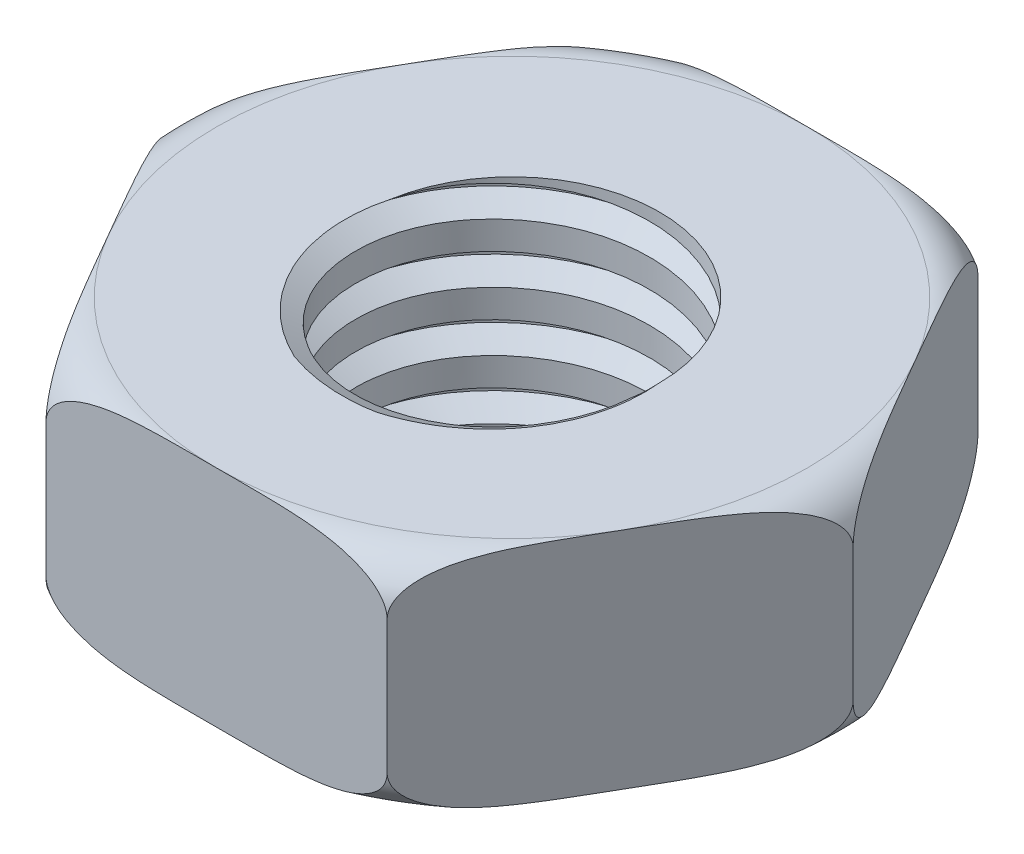
from build123d import *

# Parameters (mm, degrees)
SKETCH1_R           = 1.25
BOSS_EXTRUDE1_DEPTH = 0.95
THREAD1_PITCH       = 0.5


with BuildPart() as part:
    # Sketch1 → Boss-Extrude1 (new, symmetric)
    with BuildSketch(Plane(origin=(0, 0, 0), x_dir=(1, 0, 0), z_dir=(0, 1, 0))):
        Polygon((2.886751346, 0), (1.443375673, 2.5), (-1.443375673, 2.5), (-2.886751346, 0), (-1.443375673, -2.5), (1.443375673, -2.5), align=None)
        with Locations(Location((0, 0, 0), (0, 0, 90))):
            Circle(SKETCH1_R, mode=Mode.SUBTRACT)
    extrude(amount=BOSS_EXTRUDE1_DEPTH, both=True)

    # Cut-Revolve1: read off the stored shape, not the designer's step
    # Cut-Revolve1 outline → Cut-Revolve1 (revolve, cut)
    with BuildSketch(Plane.XY):
        with BuildLine():
            ThreePointArc((2.886751346, -0.563248654), (2.773474497, -0.836723155), (2.499999995, -0.95))
            Line((2.499999995, -0.95), (2.886751346, -0.95))
            Line((2.886751346, -0.95), (2.886751346, -0.563248654))
        make_face()
        with BuildLine():
            ThreePointArc((2.499999995, 0.95), (2.773474497, 0.836723155), (2.886751346, 0.563248654))
            Line((2.886751346, 0.563248654), (2.886751346, 0.95))
            Line((2.886751346, 0.95), (2.499999995, 0.95))
        make_face()
    revolve(axis=Axis((0, 0, 0), (0, 1, 0)), mode=Mode.SUBTRACT)

    # Thread1: arcs per turn and ends read off the stored shape
    # Thread1: the profile of Thread Profile1 profile screwed along a right-hand helix through 10 turns, 6 arcs to a turn; built about Z, then put on its axis
    thread1_z = Axis((0, 0, 0), (0, 0, 1))
    thread1_corners = [(1.2497, 0, -5.000173205), (1.439443056, 0, -4.890625), (1.439443056, 0, -4.846875), (1.2497, 0, -4.737326796)]
    with BuildLine(mode=Mode.PRIVATE) as thread1_profile:
        Line(thread1_corners[0], thread1_corners[1])
        Line(thread1_corners[1], thread1_corners[2])
        Line(thread1_corners[2], thread1_corners[3])
        Line(thread1_corners[3], thread1_corners[0])
    thread1_cap = Face(thread1_profile.wire())
    thread1_turn_angles = [0, 30, 60, 90, 120, 150, 180, 210, 240, 270, 300, 330, 360]
    thread1_turn_weights = [1, 0.8660254037844387, 1, 0.8660254037844387, 1, 0.8660254037844387, 1, 0.8660254037844387, 1, 0.8660254037844387, 1, 0.8660254037844387, 1]
    thread1_turn_rails = [Edge.make_bspline([Vector(p[0], p[1], 0).rotate(thread1_z, thread1_turn_angles[k]) / thread1_turn_weights[k] + Vector(0, 0, p[2] + THREAD1_PITCH * thread1_turn_angles[k] / 360) for k in range(13)], [0, 0, 0, 1, 1, 2, 2, 3, 3, 4, 4, 5, 5, 6, 6, 6], 2, thread1_turn_weights) for p in thread1_corners]
    thread1_turn_sides = [Face.make_surface_from_curves(thread1_turn_rails[p[0]], thread1_turn_rails[p[1]]) for p in [(0, 1), (1, 2), (2, 3), (3, 0)]]
    thread1 = Plane(origin=(0, 0.95, 0), x_dir=(1, 0, 0), z_dir=(0, 1, 0)) * Solid(Shell([*[p.moved(Location((0, 0, THREAD1_PITCH * i))) for i in range(10) for p in thread1_turn_sides], thread1_cap, thread1_cap.rotate(thread1_z, 3600).moved(Location((0, 0, THREAD1_PITCH * 3600 / 360)))]))
    add(thread1, mode=Mode.SUBTRACT)


solid = part.part
